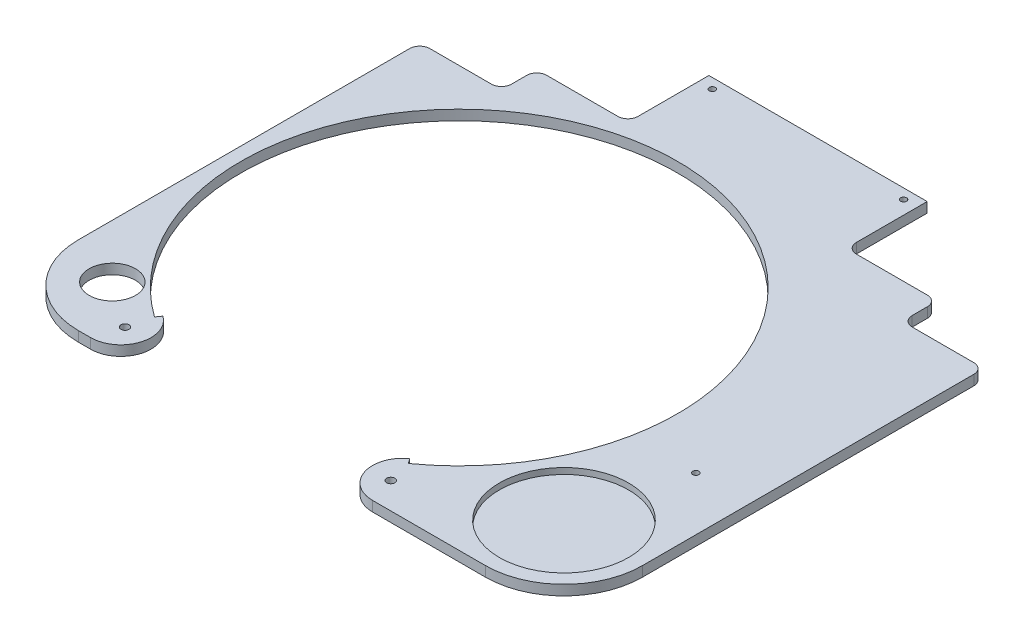
from build123d import *

# Parameters (mm, degrees)
ESQUISSE1_W             = 280.2
ESQUISSE1_H             = 276.282873123
BOSS_EXTRU_1_DEPTH      = 5
ENL_V_MAT_EXTRU_1_DEPTH = 283.344868376
ENL_V_MAT_EXTRU_3_DEPTH = 283.344868376
ESQUISSE5_R             = 2
ENL_V_MAT_EXTRU_4_DEPTH = 283.344868376
ENL_V_MAT_EXTRU_5_DEPTH = 283.344868376
ESQUISSE7_R             = 11.5
ENL_V_MAT_EXTRU_6_DEPTH = 283.344868376
ENL_V_MAT_EXTRU_7_DEPTH = 3
ESQUISSE8_R             = 1.5
ENL_V_MAT_EXTRU_8_DEPTH = 283.344868376


with BuildPart() as part:
    # Esquisse1 → Boss.-Extru.1 (new body)
    with BuildSketch(Plane(origin=(0, 0, 0), x_dir=(1, 0, 0), z_dir=(0, 1, 0))):
        with Locations((0, -106.941436562)):
            Rectangle(ESQUISSE1_W, ESQUISSE1_H)
    extrude(amount=BOSS_EXTRU_1_DEPTH)

    # Esquisse2 → Enlèv. mat.-Extru.1 (cut, through all)
    with BuildSketch(Plane(origin=(0, 5, 0), x_dir=(1, 0, 0), z_dir=(0, 1, 0))):
        with BuildLine():
            Line((-86.286307054, -217.873386842), (-88.029045643, -220.315284098))
            ThreePointArc((-88.029045643, -220.315284098), (-128.330678708, -98.90890093), (-25, -23.5))
            ThreePointArc((-25, -23.5), (78.330678708, -98.90890093), (38.029045643, -220.315284098))
            Line((38.029045643, -220.315284098), (36.286307054, -217.873386842))
            ThreePointArc((36.286307054, -217.873386842), (30.714652713, -234.657679446), (45, -245.082873123))
            Line((45, -245.082873123), (-95, -245.082873123))
            ThreePointArc((-95, -245.082873123), (-80.714652713, -234.657679446), (-86.286307054, -217.873386842))
        make_face()
    extrude(amount=-ENL_V_MAT_EXTRU_1_DEPTH, mode=Mode.SUBTRACT)

    # Esquisse4 → Enlèv. mat.-Extru.3 (cut, through all)
    with BuildSketch(Plane(origin=(0, 5, 0), x_dir=(1, 0, 0), z_dir=(0, 1, 0))):
        with BuildLine():
            Line((140.1, -245.082873123), (101.1, -245.082873123))
            ThreePointArc((101.1, -245.082873123), (128.677164466, -233.660037589), (140.1, -206.082873123))
            Line((140.1, -206.082873123), (140.1, -245.082873123))
        make_face()
        with BuildLine():
            Line((-101.1, -245.082873123), (-140.1, -245.082873123))
            Line((-140.1, -245.082873123), (-140.1, -206.082873123))
            ThreePointArc((-140.1, -206.082873123), (-128.677164466, -233.660037589), (-101.1, -245.082873123))
        make_face()
    extrude(amount=-ENL_V_MAT_EXTRU_3_DEPTH, mode=Mode.SUBTRACT)

    # Esquisse5 → Enlèv. mat.-Extru.4 (cut, through all)
    with BuildSketch(Plane(origin=(0, 5, 0), x_dir=(1, 0, 0), z_dir=(0, 1, 0))):
        with Locations((-91, -232)):
            Circle(ESQUISSE5_R)
        with Locations((41, -232)):
            Circle(ESQUISSE5_R)
    extrude(amount=-ENL_V_MAT_EXTRU_4_DEPTH, mode=Mode.SUBTRACT)

    # Esquisse6 → Enlèv. mat.-Extru.5 (cut, through all)
    with BuildSketch(Plane(origin=(0, 5, 0), x_dir=(1, 0, 0), z_dir=(0, 1, 0))):
        with BuildLine():
            Line((140.1, 31.2), (0, 31.2))
            Line((0, 31.2), (-140.1, 31.2))
            Line((-140.1, 31.2), (-140.1, -41.5125))
            ThreePointArc((-140.1, -41.5125), (-138.635533906, -37.976966094), (-135.1, -36.5125))
            Line((-135.1, -36.5125), (-104.5, -36.5125))
            ThreePointArc((-104.5, -36.5125), (-100.964466094, -35.048033906), (-99.5, -31.5125))
            Line((-99.5, -31.5125), (-99.5, -24))
            ThreePointArc((-99.5, -24), (-98.035533906, -20.464466094), (-94.5, -19))
            Line((-94.5, -19), (-59.209388013, -19))
            ThreePointArc((-59.209388013, -19), (-55.673854107, -17.535533906), (-54.209388013, -14))
            Line((-54.209388013, -14), (-54.209388013, 21.2))
            Line((-54.209388013, 21.2), (54.209388013, 21.2))
            Line((54.209388013, 21.2), (54.209388013, -14))
            ThreePointArc((54.209388013, -14), (55.673854107, -17.535533906), (59.209388013, -19))
            Line((59.209388013, -19), (94.5, -19))
            ThreePointArc((94.5, -19), (98.035533906, -20.464466094), (99.5, -24))
            Line((99.5, -24), (99.5, -31.5125))
            ThreePointArc((99.5, -31.5125), (100.964466094, -35.048033906), (104.5, -36.5125))
            Line((104.5, -36.5125), (135.1, -36.5125))
            ThreePointArc((135.1, -36.5125), (138.635533906, -37.976966094), (140.1, -41.5125))
            Line((140.1, -41.5125), (140.1, 31.2))
        make_face()
    extrude(amount=-ENL_V_MAT_EXTRU_5_DEPTH, mode=Mode.SUBTRACT)

    # Esquisse7 → Enlèv. mat.-Extru.6 (cut, through all)
    with BuildSketch(Plane(origin=(0, 5, 0), x_dir=(1, 0, 0), z_dir=(0, 1, 0))):
        with Locations((-113.5, -215.8)):
            Circle(ESQUISSE7_R)
    extrude(amount=-ENL_V_MAT_EXTRU_6_DEPTH, mode=Mode.SUBTRACT)

    # Esquisse3 → Enlèv. mat.-Extru.7 (cut)
    with BuildSketch(Plane(origin=(0, 5, 0), x_dir=(1, 0, 0), z_dir=(0, 1, 0))):
        with BuildLine():
            ThreePointArc((89.861120923, -236.142437027), (131.159563905, -217.3217522), (112.338879077, -176.023309218))
            ThreePointArc((112.338879077, -176.023309218), (71.040436095, -194.843994045), (89.861120923, -236.142437027))
        make_face()
    extrude(amount=-ENL_V_MAT_EXTRU_7_DEPTH, mode=Mode.SUBTRACT)

    # Esquisse8 → Enlèv. mat.-Extru.8 (cut, through all)
    with BuildSketch(Plane.XZ):
        with Locations((113.5, 153)):
            Circle(ESQUISSE8_R)
        with Locations((47.5, -16.2)):
            Circle(ESQUISSE8_R)
        with Locations((-47.5, -16.2)):
            Circle(ESQUISSE8_R)
    extrude(amount=-ENL_V_MAT_EXTRU_8_DEPTH, mode=Mode.SUBTRACT)


solid = part.part
